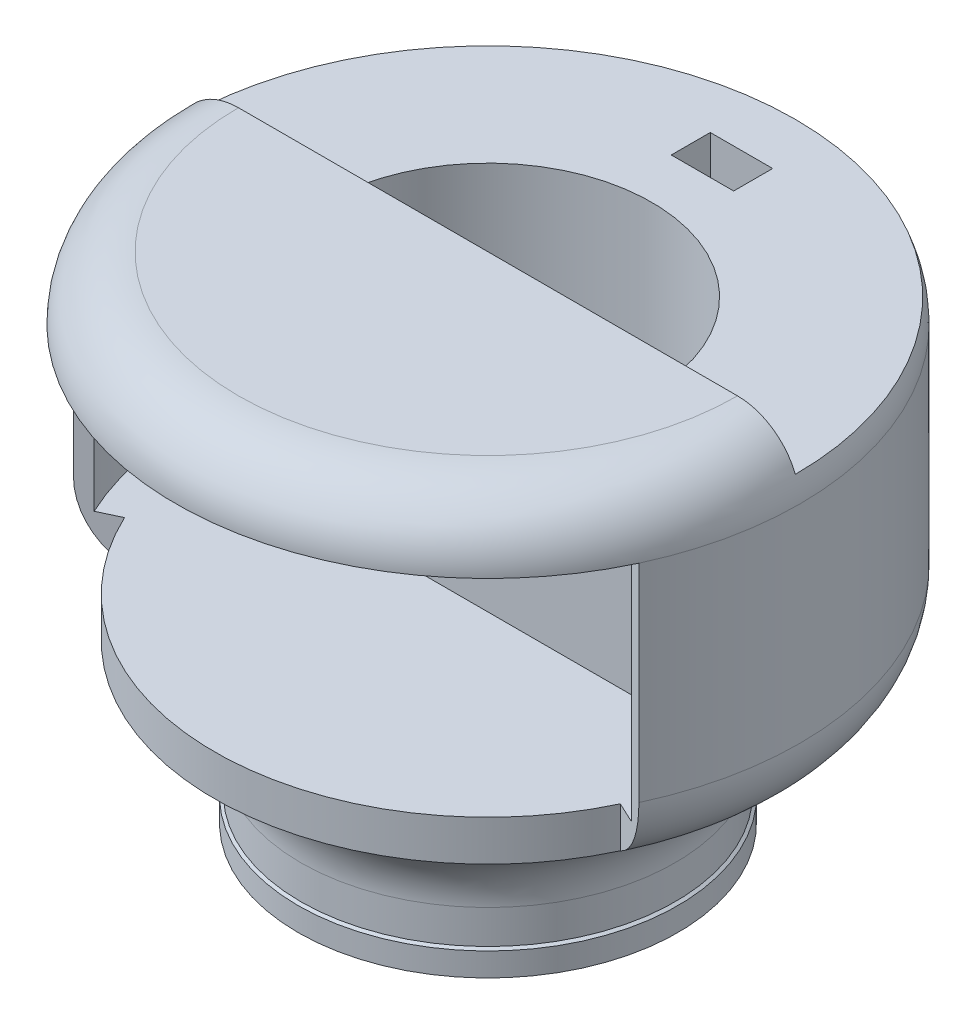
from build123d import *

# Parameters (mm, degrees)
CUT_EXTRUDE3_DEPTH           = 60
CUT_EXTRUDE5_DEPTH           = 2
CUT_EXTRUDE5_DEPTH_BACK      = 30
SKETCH9_R                    = 38
SKETCH9_R_2                  = 23
SKETCH19_W                   = 12
SKETCH19_H                   = 36.5
CUT_REVOLVE2_ANGLE           = 65
CUT_REVOLVE2_OTHER_WAY_ANGLE = 65
SKETCH21_W                   = 3.25
SKETCH21_H                   = 4
BOSS_EXTRUDE3_DEPTH          = 1.35
CIRPATTERN1_COUNT            = 5
CUT_EXTRUDE9_START           = -5
CUT_EXTRUDE9_DEPTH           = 5
SKETCH23_R                   = 10.5
CUT_EXTRUDE10_DEPTH          = 10
SKETCH24_W                   = 15
SKETCH24_H                   = 8
BOSS_EXTRUDE4_DEPTH          = 8
SKETCH26_W                   = 8
SKETCH26_H                   = 5
CUT_EXTRUDE11_DEPTH          = 10
SKETCH27_W                   = 4
SKETCH27_H                   = 5
CUT_EXTRUDE12_DEPTH          = 5
CUT_EXTRUDE14_DEPTH          = 30


with BuildPart() as part:
    # Sketch1 → Revolve1 (revolve)
    with BuildSketch(Plane.XY):
        with BuildLine():
            Line((0, 63.427876097), (32, 63.427876097))
            ThreePointArc((32, 63.427876097), (37.656854249, 61.084730346), (40, 55.427876097))
            Line((40, 55.427876097), (40, 28.846818009))
            ThreePointArc((40, 28.846818009), (38.792081772, 24.082439968), (35.460140376, 20.469057744))
            Line((35.460140376, 20.469057744), (28.539859624, 15.958818353))
            ThreePointArc((28.539859624, 15.958818353), (25.207918228, 12.345436129), (24, 7.581058088))
            Line((24, 7.581058088), (24, 3.25))
            Line((24, 3.25), (24.35, 3))
            Line((24.35, 3), (24.35, 0))
            Line((24.35, 0), (22.5, 0))
            Line((22.5, 0), (22.5, 12.5))
            ThreePointArc((22.5, 12.5), (22.353553391, 12.853553391), (22, 13))
            Line((22, 13), (0, 13))
            Line((0, 13), (0, 63.427876097))
        make_face()
    revolve(axis=Axis((0, 0, 0), (0, 1, 0)))

    # Sketch11 → Cut-Extrude3 (cut)
    with BuildSketch(Plane(origin=(0, 13, 0), x_dir=(-1, 0, 0), z_dir=(0, -1, 0))):
        with BuildLine():
            Line((-21, 0), (21, 0))
            ThreePointArc((21, 0), (0, 21), (-21, 0))
        make_face()
    extrude(amount=-CUT_EXTRUDE3_DEPTH, mode=Mode.SUBTRACT)

    # Sketch9 → Cut-Extrude5 (cut, two sides: drawn at the far end of the back side and taken through both)
    with BuildSketch(Plane(origin=(0, 55.427876097, 0), x_dir=(1, 0, 0), z_dir=(0, 1, 0)).offset(-CUT_EXTRUDE5_DEPTH_BACK)):
        Circle(SKETCH9_R)
        Circle(SKETCH9_R_2, mode=Mode.SUBTRACT)
    extrude(amount=CUT_EXTRUDE5_DEPTH + CUT_EXTRUDE5_DEPTH_BACK, mode=Mode.SUBTRACT)

    # Sketch19 → Cut-Revolve2 (revolve, cut)
    with BuildSketch(Plane(origin=(0, 0, 0), x_dir=(0, 0, -1), z_dir=(1, 0, 0))):
        with Locations((-41.064715832, 37.177876097)):
            Rectangle(SKETCH19_W, SKETCH19_H)
    revolve(axis=Axis((0, 0, 0), (0, 1, 0)), revolution_arc=CUT_REVOLVE2_ANGLE, mode=Mode.SUBTRACT)

    # Sketch19 → Cut-Revolve2 other way (revolve, cut)
    with BuildSketch(Plane(origin=(0, 0, 0), x_dir=(0, 0, -1), z_dir=(1, 0, 0))):
        with Locations((-41.064715832, 37.177876097)):
            Rectangle(SKETCH19_W, SKETCH19_H)
    revolve(axis=Axis((0, 0, 0), (0, -1, 0)), revolution_arc=CUT_REVOLVE2_OTHER_WAY_ANGLE, mode=Mode.SUBTRACT)

    # Sketch21 → Boss-Extrude3 (add)
    with BuildSketch(Plane(origin=(0, 0, 22.5), x_dir=(-1, 0, 0), z_dir=(0, 0, -1))):
        with Locations((0, 2)):
            Rectangle(SKETCH21_W, SKETCH21_H)
    boss_extrude3 = extrude(amount=BOSS_EXTRUDE3_DEPTH)

    # CirPattern1: Boss-Extrude3 ×5 about axis
    cirpattern1_axis = Axis((0, 0, 0), (0, -1, 0))
    for i in range(1, CIRPATTERN1_COUNT):
        add(boss_extrude3.rotate(cirpattern1_axis, i * 360 / CIRPATTERN1_COUNT))

    # Sketch22 → Cut-Extrude9 (cut)
    with BuildSketch(Plane(origin=(0, 63.427876097, 0), x_dir=(1, 0, 0), z_dir=(0, 1, 0)).offset(CUT_EXTRUDE9_START)):
        with BuildLine():
            Line((-40, 0), (40, 0))
            ThreePointArc((40, 0), (0, 40), (-40, 0))
        make_face()
    extrude(amount=CUT_EXTRUDE9_DEPTH, mode=Mode.SUBTRACT)

    # Sketch23 → Cut-Extrude10 (cut)
    with BuildSketch(Plane(origin=(0, 0, -40), x_dir=(-1, 0, 0), z_dir=(0, 0, -1))):
        with Locations((0, 42.137876097)):
            Circle(SKETCH23_R)
    extrude(amount=-CUT_EXTRUDE10_DEPTH, mode=Mode.SUBTRACT)

    # Sketch24 → Boss-Extrude4 (add)
    with BuildSketch(Plane(origin=(0, 58.427876097, 0), x_dir=(1, 0, 0), z_dir=(0, 1, 0))):
        with Locations((0, 30)):
            Rectangle(SKETCH24_W, SKETCH24_H)
    extrude(amount=-BOSS_EXTRUDE4_DEPTH)

    # Sketch26 → Cut-Extrude11 (cut)
    with BuildSketch(Plane(origin=(0, 58.427876097, 0), x_dir=(1, 0, 0), z_dir=(0, 1, 0))):
        with Locations((0, 30)):
            Rectangle(SKETCH26_W, SKETCH26_H)
    extrude(amount=-CUT_EXTRUDE11_DEPTH, mode=Mode.SUBTRACT)

    # Sketch27 → Cut-Extrude12 (cut)
    with BuildSketch(Plane(origin=(7.5, 0, 0), x_dir=(0, 0, -1), z_dir=(1, 0, 0))):
        with Locations((30, 53.927876097)):
            Rectangle(SKETCH27_W, SKETCH27_H)
    extrude(amount=-CUT_EXTRUDE12_DEPTH, mode=Mode.SUBTRACT)

    # Sketch28 → Cut-Extrude14 (cut)
    with BuildSketch(Plane(origin=(0, 55.427876097, 0), x_dir=(1, 0, 0), z_dir=(0, 1, 0))):
        with BuildLine():
            Line((-22.912878475, -2), (22.912878475, -2))
            ThreePointArc((22.912878475, -2), (0, -23), (-22.912878475, -2))
        make_face()
    extrude(amount=-CUT_EXTRUDE14_DEPTH, mode=Mode.SUBTRACT)


solid = part.part
